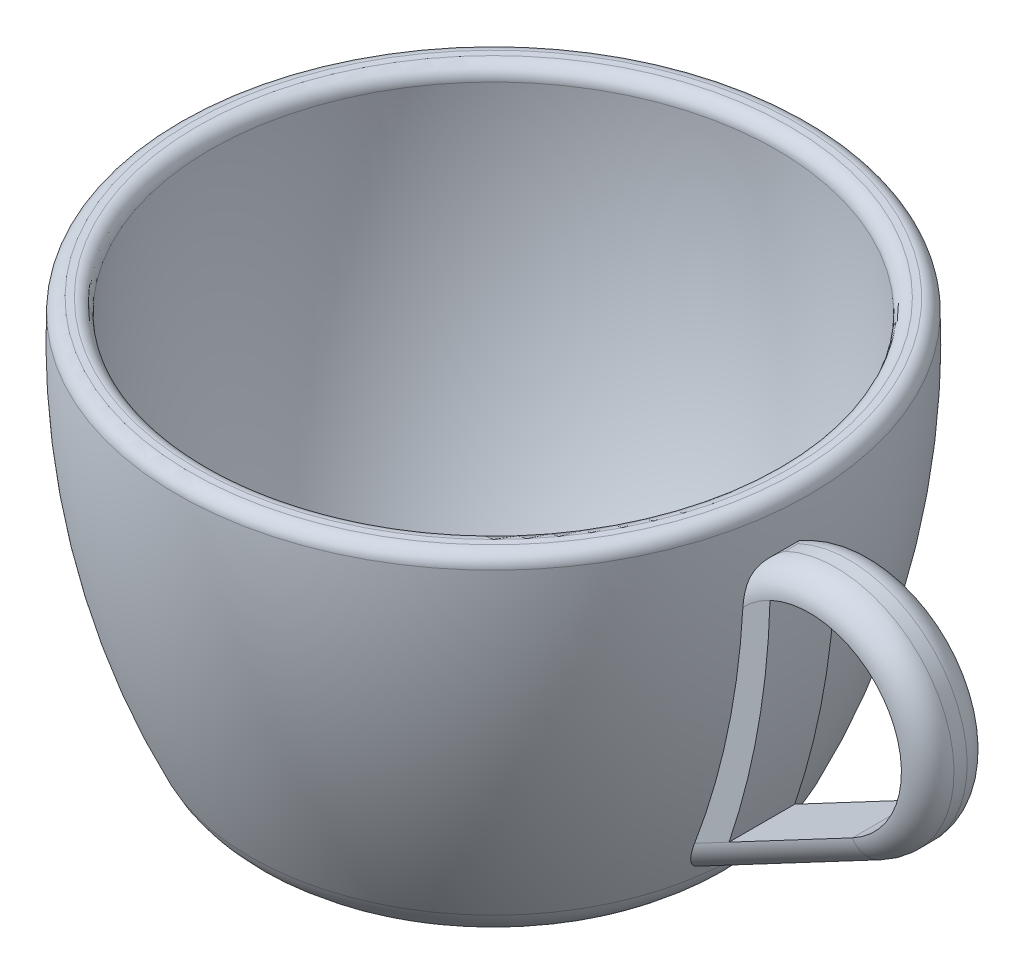
from build123d import *

# Parameters (mm, degrees)
CROQUIS6_R              = 21.5
SALIENTE_EXTRUIR1_DEPTH = 0.1
REDONDEO2_R             = 1
REDONDEO3_R             = 5
SALIENTE_EXTRUIR2_DEPTH = 5
REDONDEO4_R             = 2


# Read off the part's stored shape, not the designer's step: Vaciado2
with BuildPart() as part:
    # Croquis3 → Revolución1 (revolve)
    with BuildSketch(Plane.XY):
        with BuildLine():
            Line((0, -15.25), (0, 15.25))
            Line((0, 15.25), (24, 15.25))
            ThreePointArc((24, 15.25), (22.595823948, -0.481008775), (17, -15.25))
            Line((17, -15.25), (0, -15.25))
        make_face()
    revolve(axis=Axis((0, -15.25, 0), (0, 1, 0)))

    # Croquis6 → Saliente-Extruir1 (add)
    with BuildSketch(Plane(origin=(0, 15.25, 0), x_dir=(1, 0, 0), z_dir=(0, 1, 0))):
        Circle(CROQUIS6_R)
    extrude(amount=-SALIENTE_EXTRUIR1_DEPTH)

    # Vaciado2 outline → Vaciado2 (revolve, cut)
    with BuildSketch(Plane.XY):
        with BuildLine():
            Line((0, 15.25), (0, -12.75))
            Line((0, -12.75), (15.492606695, -12.75))
            ThreePointArc((15.492606695, -12.75), (20.331827808, 0.856065473), (21.497043449, 15.25))
            Line((21.497043449, 15.25), (0, 15.25))
        make_face()
    revolve(axis=Axis((0, 0, 0), (0, 1, 0)), mode=Mode.SUBTRACT)

    # Redondeo2
    redondeo2_edges = [part.edges().sort_by_distance(p)[0] for p in [
        (-21.497043449, 15.25, 0),
        (-24, 15.25, 0),
    ]]
    fillet(redondeo2_edges, radius=REDONDEO2_R)

    # Redondeo3
    redondeo3_edges = [part.edges().sort_by_distance(p)[0] for p in [
        (-17, -15.25, 0),
    ]]
    fillet(redondeo3_edges, radius=REDONDEO3_R)


with BuildPart() as body_2:
    # Croquis15 → Saliente-Extruir2 (new body)
    with BuildSketch(Plane.XY):
        with BuildLine():
            Line((19.118047296, -10.94684007), (33.254196803, -3.452223528))
            ThreePointArc((33.254196803, -3.452223528), (36.773561649, 9.100277273), (24.063453665, 11.999304752))
            ThreePointArc((24.063453665, 11.999304752), (22.763691887, 0.273437288), (19.118047296, -10.94684007))
        make_face()
        with BuildLine():
            Line((22.92475169, -6.664925133), (32.317369735, -1.68520484))
            ThreePointArc((32.317369735, -1.68520484), (35.295559587, 7.637655082), (26.042383639, 10.825768442))
            ThreePointArc((26.042383639, 10.825768442), (25.134542596, 1.964388506), (22.92475169, -6.664925133))
        make_face(mode=Mode.SUBTRACT)
    extrude(amount=SALIENTE_EXTRUIR2_DEPTH)

    # Redondeo4
    redondeo4_edges = [body_2.edges().sort_by_distance(p)[0] for p in [
        (36.773561649, 9.100277273, 5),
        (36.773561649, 9.100277273, 0),
        (26.186122049, -7.199531799, 0),
        (24.063453665, 11.999304752, 2.5),
        (26.186122049, -7.199531799, 5),
    ]]
    fillet(redondeo4_edges, radius=REDONDEO4_R - 0.0001)  # a hair under: the kernel refuses the full size


solid = Compound([part.part, body_2.part])
